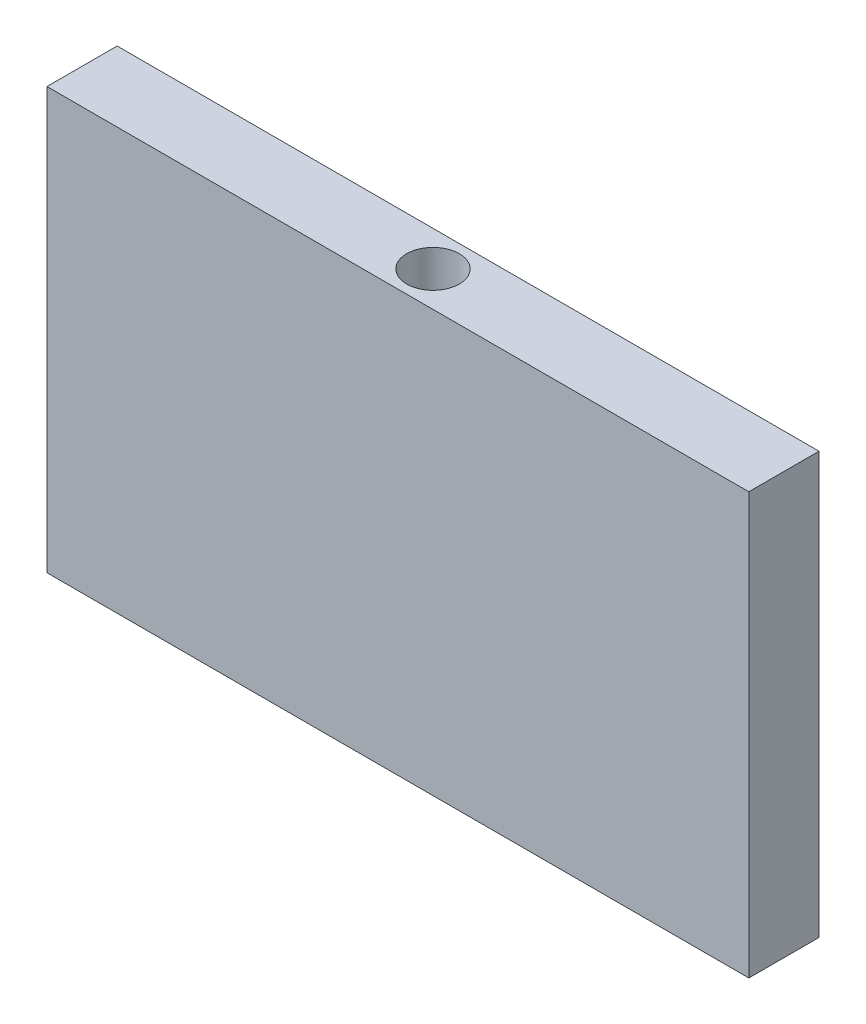
from build123d import *

# Parameters (mm, degrees)
SKETCH1_W           = 40
SKETCH1_H           = 4
BOSS_EXTRUDE1_DEPTH = 24
SKETCH2_R           = 1.5
CUT_EXTRUDE1_DEPTH  = 6


with BuildPart() as part:
    # Sketch1 → Boss-Extrude1 (new body)
    with BuildSketch(Plane(origin=(0, 0, 0), x_dir=(1, 0, 0), z_dir=(0, 1, 0))):
        Rectangle(SKETCH1_W, SKETCH1_H)
    extrude(amount=BOSS_EXTRUDE1_DEPTH)

    # Sketch2 → Cut-Extrude1 (cut)
    with BuildSketch(Plane.XZ):
        Circle(SKETCH2_R)
    cut_extrude1 = extrude(amount=-CUT_EXTRUDE1_DEPTH, mode=Mode.SUBTRACT)

    # Mirror1: Cut-Extrude1 across plane
    add(cut_extrude1.mirror(Plane(origin=(0, 12, 0), x_dir=(0, 0, 1), z_dir=(0, -1, 0))), mode=Mode.SUBTRACT)


solid = part.part
